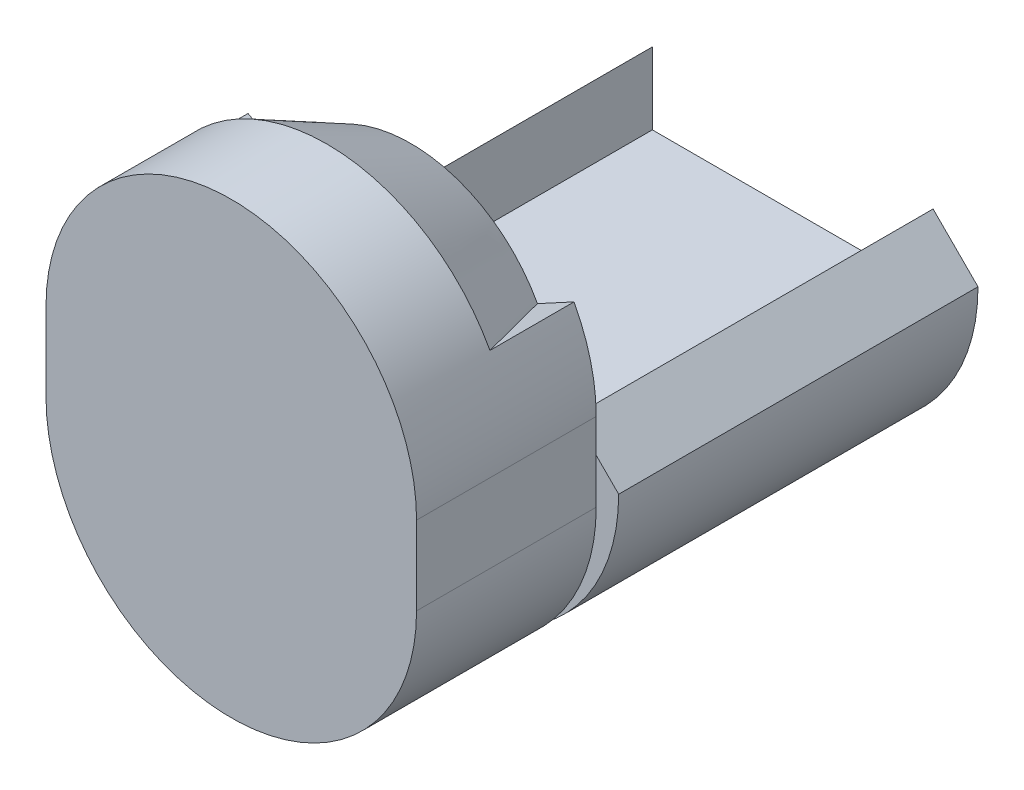
from build123d import *

# Parameters (mm, degrees)
BOSS_EXTRUDE1_DEPTH = 101.6
BOSS_EXTRUDE2_DEPTH = 50.8


with BuildPart() as part:
    # Sketch1 → Boss-Extrude1 (new body)
    with BuildSketch(Plane.XY):
        with BuildLine():
            Line((-39.730837156, -2.54), (39.644162844, -2.54))
            Line((39.644162844, -2.54), (39.644162844, 17.78))
            Line((39.644162844, 17.78), (52.344162844, 5.08))
            ThreePointArc((52.344162844, 5.08), (-0.043337156, -47.3075), (-52.430837156, 5.08))
            Line((-52.430837156, 5.08), (-39.730837156, 17.78))
            Line((-39.730837156, 17.78), (-39.730837156, -2.54))
        make_face()
    extrude(amount=BOSS_EXTRUDE1_DEPTH)


with BuildPart() as body_2:
    # Sketch3 → Boss-Extrude2 (new body)
    with BuildSketch(Plane.XY.offset(158.75)):
        with BuildLine():
            Line((-52.430837156, 5.08), (-52.430837156, 27.305))
            ThreePointArc((-52.430837156, 27.305), (-0.043337156, 79.6925), (52.344162844, 27.305))
            Line((52.344162844, 27.305), (52.344162844, 5.08))
            ThreePointArc((52.344162844, 5.08), (-0.043337156, -47.3075), (-52.430837156, 5.08))
        make_face()
    extrude(amount=-BOSS_EXTRUDE2_DEPTH)

    # Cut-Sweep1: sweep along a path in Sketch8
    with BuildLine(Plane(origin=(0, 0, 107.95), x_dir=(-1, 0, 0), z_dir=(0, 0, -1))) as cut_sweep1_path:
        ThreePointArc((-46.051899441, 52.198358941), (0, 79.692482075), (46.097324999, 52.274588703))
    # Sketch6 → Cut-Sweep1 (sweep, cut)
    with BuildSketch(Plane(origin=(0, 0, 0), x_dir=(0, 0, -1), z_dir=(1, 0, 0))):
        Polygon((-131.703984044, 79.6925), (-107.95, 67.945), (-107.95, 79.6925), align=None)
    sweep(path=cut_sweep1_path.line, mode=Mode.SUBTRACT)


solid = Compound([part.part, body_2.part])
